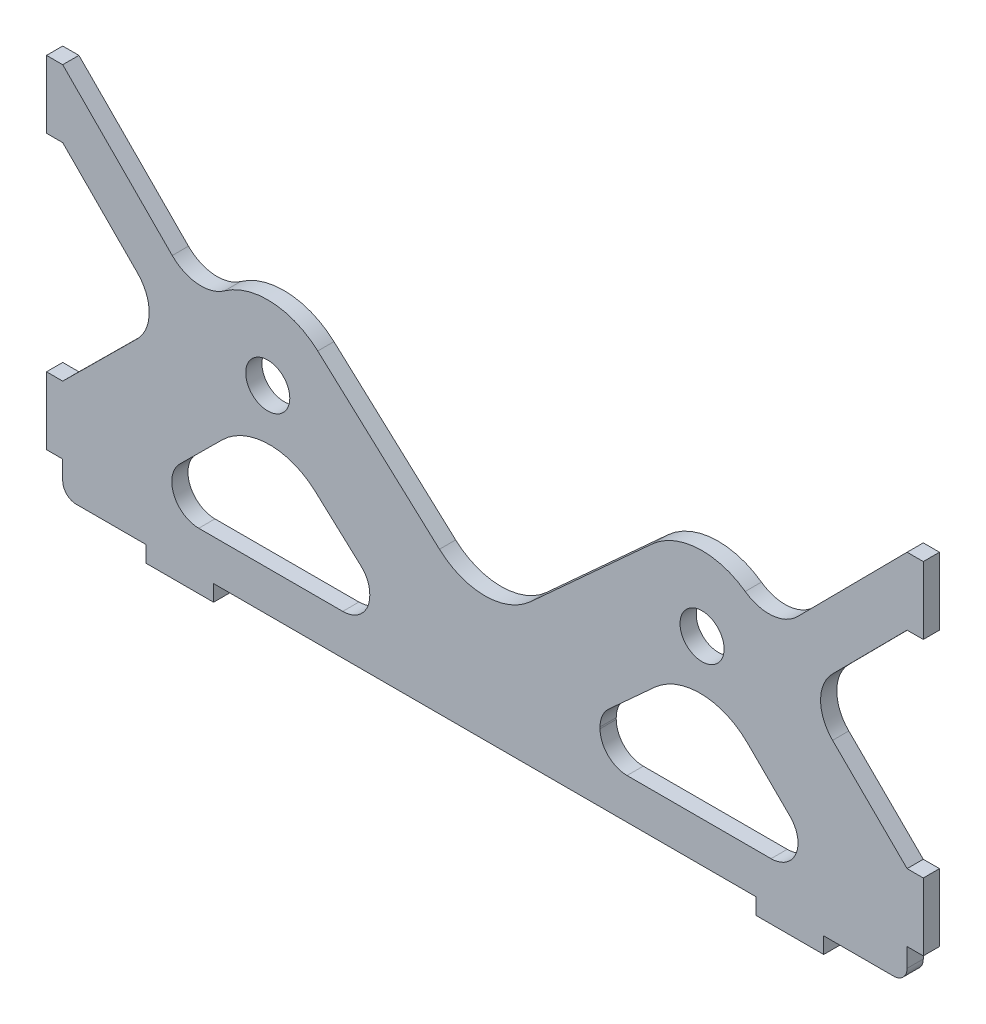
from build123d import *

# Parameters (mm, degrees)
SKETCH1_R            = 4.14655
BOSS_EXTRUDE1_DEPTH  = 3.048
FILLET1_R            = 12.7
CUT_EXTRUDE1_DEPTH   = 98.209690942
FILLET2_R            = 5.08
FILLET2_OF_MIRROR1_R = 5.08
BOSS_EXTRUDE2_DEPTH  = 3.048
FILLET3_R            = 7.62


with BuildPart() as part:
    # Sketch1 → Boss-Extrude1 (new body)
    with BuildSketch(Plane.XY):
        with BuildLine():
            Line((51.054, 0), (-51.054, 0))
            Line((-51.054, 0), (-51.054, -3.048))
            Line((-51.054, -3.048), (-63.754, -3.048))
            Line((-63.754, -3.048), (-63.754, 0))
            Line((-63.754, 0), (-76.901088515, 0))
            ThreePointArc((-76.901088515, 0), (-78.697139739, 0.743948776), (-79.441088515, 2.54))
            Line((-79.441088515, 2.54), (-79.441088515, 6.096))
            Line((-79.441088515, 6.096), (-82.489088515, 6.096))
            Line((-82.489088515, 6.096), (-82.489088515, 18.796))
            Line((-82.489088515, 18.796), (-79.441088515, 18.796))
            Line((-79.441088515, 18.796), (-50.69543442, 47.292942568))
            ThreePointArc((-50.69543442, 47.292942568), (-41.155344062, 51.338715816), (-31.452840209, 47.699619198))
            Line((-31.452840209, 47.699619198), (0, 19.05))
            Line((0, 19.05), (31.452840209, 47.699619198))
            ThreePointArc((31.452840209, 47.699619198), (41.155344062, 51.338715816), (50.69543442, 47.292942568))
            Line((50.69543442, 47.292942568), (79.441088515, 18.796))
            Line((79.441088515, 18.796), (82.489088515, 18.796))
            Line((82.489088515, 18.796), (82.489088515, 6.096))
            Line((82.489088515, 6.096), (79.441088515, 6.096))
            Line((79.441088515, 6.096), (79.441088515, 2.54))
            ThreePointArc((79.441088515, 2.54), (78.697139739, 0.743948776), (76.901088515, 0))
            Line((76.901088515, 0), (63.754, 0))
            Line((63.754, 0), (63.754, -3.048))
            Line((63.754, -3.048), (51.054, -3.048))
            Line((51.054, -3.048), (51.054, 0))
        make_face()
        with Locations((40.860165351, 37.371834649)):
            Circle(SKETCH1_R, mode=Mode.SUBTRACT)
        with Locations((-40.860165351, 37.371834649)):
            Circle(SKETCH1_R, mode=Mode.SUBTRACT)
    extrude(amount=-BOSS_EXTRUDE1_DEPTH)

    # Fillet1
    fillet1_edges = [part.edges().sort_by_distance(p)[0] for p in [
        (0, 19.05, -1.524),
    ]]
    fillet(fillet1_edges, radius=FILLET1_R)

    # Sketch3 → Cut-Extrude1 (cut, symmetric)
    with BuildSketch(Plane.XY):
        with BuildLine():
            Line((-49.43113261, 24.225449161), (-66.181508428, 7.62))
            Line((-66.181508428, 7.62), (-21.667355118, 7.62))
            Line((-21.667355118, 7.62), (-21.667355118, 15.24))
            Line((-21.667355118, 15.24), (-31.937865146, 24.595155188))
            ThreePointArc((-31.937865146, 24.595155188), (-40.758323194, 27.903424841), (-49.43113261, 24.225449161))
        make_face()
    cut_extrude1 = extrude(amount=CUT_EXTRUDE1_DEPTH, both=True, mode=Mode.SUBTRACT)

    # Fillet2
    fillet2_edges = [part.edges().sort_by_distance(p)[0] for p in [
        (-21.667355118, 7.62, -1.524),
        (-66.181508428, 7.62, -1.524),
        (-21.667355118, 15.24, -1.524),
    ]]
    fillet(fillet2_edges, radius=FILLET2_R)

    # Mirror1: Cut-Extrude1 across plane
    add(cut_extrude1.mirror(Plane(origin=(0, 0, 0), x_dir=(0, 0, 1), z_dir=(1, 0, 0))), mode=Mode.SUBTRACT)

    # Fillet2 of Mirror1
    fillet2_of_mirror1_edges = [part.edges().sort_by_distance(p)[0] for p in [
        (21.667355118, 7.62, -1.524),
        (66.181508428, 7.62, -1.524),
        (21.667355118, 15.24, -1.524),
    ]]
    fillet(fillet2_of_mirror1_edges, radius=FILLET2_OF_MIRROR1_R)

    # Sketch4 → Boss-Extrude2 (add)
    with BuildSketch(Plane(origin=(0, 0, -3.048), x_dir=(-1, 0, 0), z_dir=(0, 0, -1))):
        Polygon((-82.489088515, 70.358), (-79.441088515, 70.358), (-53.661061877, 44.352974145), (-60.010822133, 38.058152927), (-79.441088515, 57.658), (-82.489088515, 57.658), align=None)
    boss_extrude2 = extrude(amount=-BOSS_EXTRUDE2_DEPTH)

    # Mirror3: Boss-Extrude2 across plane
    add(boss_extrude2.mirror(Plane(origin=(0, 0, 0), x_dir=(0, 0, 1), z_dir=(1, 0, 0))))

    # Fillet3
    fillet3_edges = [part.edges().sort_by_distance(p)[0] for p in [
        (60.010822133, 38.058152927, -1.524),
        (53.661061877, 44.352974145, -1.524),
        (-60.010822133, 38.058152927, -1.524),
        (-53.661061877, 44.352974145, -1.524),
    ]]
    fillet(fillet3_edges, radius=FILLET3_R)


solid = part.part
